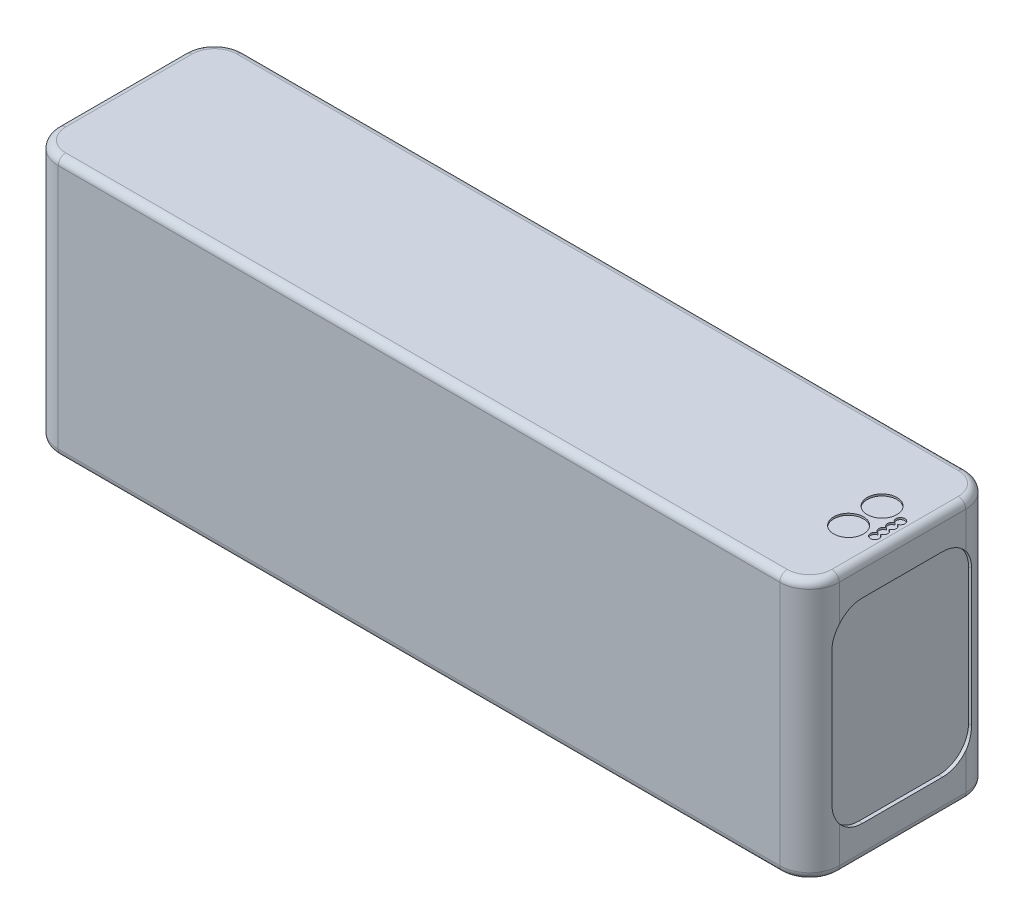
from build123d import *

# Parameters (mm, degrees)
SKETCH1_W           = 105
SKETCH1_H           = 35
BOSS_EXTRUDE1_DEPTH = 25
CUT_EXTRUDE1_DEPTH  = 0.5
CUT_EXTRUDE2_START  = -0.5
CUT_EXTRUDE2_DEPTH  = 0.5
FILLET1_R           = 4
FILLET2_R           = 1
SKETCH5_R           = 2
CUT_EXTRUDE3_DEPTH  = 0.25
CUT_EXTRUDE4_DEPTH  = 0.25


with BuildPart() as part:
    # Sketch1 → Boss-Extrude1 (new body)
    with BuildSketch(Plane(origin=(0, 0, -15), x_dir=(-1, 0, 0), z_dir=(0, 0, -1))):
        Rectangle(SKETCH1_W, SKETCH1_H)
    extrude(amount=-BOSS_EXTRUDE1_DEPTH)

    # Sketch2 → Cut-Extrude1 (cut)
    with BuildSketch(Plane(origin=(52.5, 0, 0), x_dir=(0, 0, -1), z_dir=(1, 0, 0))):
        with BuildLine():
            Line((-6.875, 9.125), (-6.875, -9.125))
            ThreePointArc((-6.875, -9.125), (-5.703427125, -11.953427125), (-2.875, -13.125))
            Line((-2.875, -13.125), (7.875, -13.125))
            ThreePointArc((7.875, -13.125), (10.703427125, -11.953427125), (11.875, -9.125))
            Line((11.875, -9.125), (11.875, 9.125))
            ThreePointArc((11.875, 9.125), (10.703427125, 11.953427125), (7.875, 13.125))
            Line((7.875, 13.125), (-2.875, 13.125))
            ThreePointArc((-2.875, 13.125), (-5.703427125, 11.953427125), (-6.875, 9.125))
        make_face()
    extrude(amount=-CUT_EXTRUDE1_DEPTH, mode=Mode.SUBTRACT)

    # Sketch3 → Cut-Extrude2 (cut)
    with BuildSketch(Plane.ZY.offset(52.5).offset(CUT_EXTRUDE2_START)):
        with BuildLine():
            Line((2.875, 13.125), (-7.875, 13.125))
            ThreePointArc((-7.875, 13.125), (-10.703427125, 11.953427125), (-11.875, 9.125))
            Line((-11.875, 9.125), (-11.875, -9.125))
            ThreePointArc((-11.875, -9.125), (-10.703427125, -11.953427125), (-7.875, -13.125))
            Line((-7.875, -13.125), (2.875, -13.125))
            ThreePointArc((2.875, -13.125), (5.703427125, -11.953427125), (6.875, -9.125))
            Line((6.875, -9.125), (6.875, 9.125))
            ThreePointArc((6.875, 9.125), (5.703427125, 11.953427125), (2.875, 13.125))
        make_face()
    extrude(amount=CUT_EXTRUDE2_DEPTH, mode=Mode.SUBTRACT)

    # Fillet1
    # the kernel refuses this fillet: 4 mm, written as the material it takes off along each edge
    with BuildSketch(Plane(origin=(-52.5, -27.5, -15), x_dir=(0, 0, 1), z_dir=(0, 1, 0)), Plane(origin=(52.5, 27.5, -15), x_dir=(0, 0, 1), z_dir=(0, -1, 0))) as fillet1_piece_1:
        with BuildLine():
            CenterArc((FILLET1_R, FILLET1_R), FILLET1_R, 180, 90)
            Line((0, FILLET1_R), (0, 0))
            Line((0, 0), (FILLET1_R, 0))
        make_face()
    extrude(amount=55, mode=Mode.SUBTRACT)
    with BuildSketch(Plane(origin=(-52.5, -27.5, 10), x_dir=(0, 0, -1), z_dir=(0, 1, 0)), Plane(origin=(52.5, 27.5, 10), x_dir=(0, 0, -1), z_dir=(0, -1, 0))) as fillet1_piece_2:
        with BuildLine():
            CenterArc((FILLET1_R, -FILLET1_R), FILLET1_R, 90, 90)
            Line((0, -FILLET1_R), (0, 0))
            Line((0, 0), (FILLET1_R, 0))
        make_face()
    extrude(amount=55, mode=Mode.SUBTRACT)

    # Fillet2
    fillet2_edges = [part.edges().sort_by_distance(p)[0] for p in [
        (0, -17.5, -15),
        (0, 17.5, -15),
        (-52.5, 17.5, -2.5),
        (0, 17.5, 10),
        (52.5, 17.5, -2.5),
        (51.328427125, 17.5, 8.828427125),
        (51.328427125, 17.5, -13.828427125),
        (-51.328427125, 17.5, 8.828427125),
        (-51.328427125, 17.5, -13.828427125),
        (-52.5, -17.5, -2.5),
        (52.5, -17.5, -2.5),
        (0, -17.5, 10),
        (51.328427125, -17.5, 8.828427125),
        (51.328427125, -17.5, -13.828427125),
        (-51.328427125, -17.5, 8.828427125),
        (-51.328427125, -17.5, -13.828427125),
    ]]
    fillet(fillet2_edges, radius=FILLET2_R)

    # Sketch5 → Cut-Extrude3 (cut)
    with BuildSketch(Plane(origin=(0, 17.5, 0), x_dir=(1, 0, 0), z_dir=(0, 1, 0))):
        with Locations(Location((47.5, 0.25, 0), (0, 0, 270))):
            Circle(SKETCH5_R)
        with Locations(Location((47.5, 4.75, 0), (0, 0, 270))):
            Circle(SKETCH5_R)
    extrude(amount=-CUT_EXTRUDE3_DEPTH, mode=Mode.SUBTRACT)

    # Sketch6 → Cut-Extrude4 (cut)
    with BuildSketch(Plane(origin=(0, 17.5, 0), x_dir=(1, 0, 0), z_dir=(0, 1, 0))):
        with BuildLine():
            ThreePointArc((50.671391365, 3.65), (50.5, 4.825), (50.328608635, 3.65))
            ThreePointArc((50.328608635, 3.65), (49.9, 3.075), (50.328608635, 2.5))
            ThreePointArc((50.328608635, 2.5), (49.9, 1.925), (50.328608635, 1.35))
            ThreePointArc((50.328608635, 1.35), (50.5, 0.175), (50.671391365, 1.35))
            ThreePointArc((50.671391365, 1.35), (51.1, 1.925), (50.671391365, 2.5))
            ThreePointArc((50.671391365, 2.5), (51.1, 3.075), (50.671391365, 3.65))
        make_face()
    extrude(amount=-CUT_EXTRUDE4_DEPTH, mode=Mode.SUBTRACT)


solid = part.part
